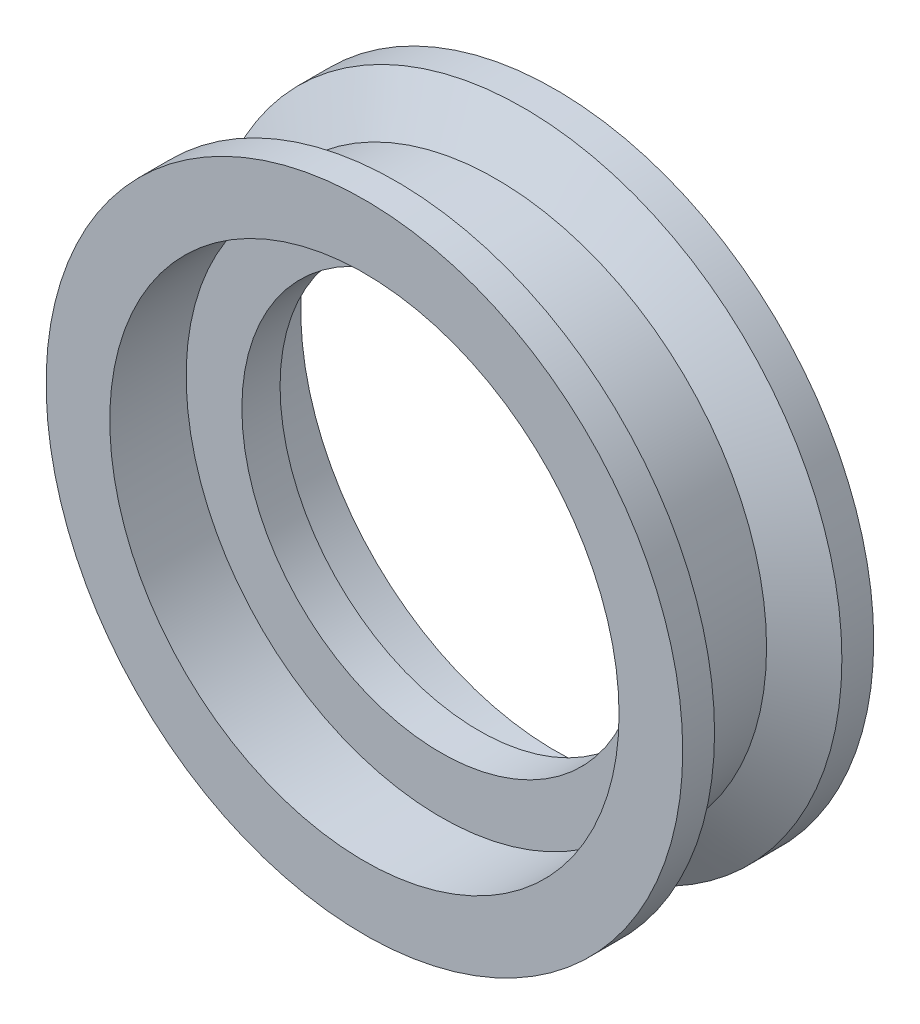
from build123d import *

# Parameters (mm, degrees)
SKETCH1_R           = 10
BOSS_EXTRUDE1_DEPTH = 3
SKETCH2_R           = 8
CUT_EXTRUDE1_DEPTH  = 2.4
SKETCH6_R           = 6.25
CUT_EXTRUDE2_DEPTH  = 15.593149078


with BuildPart() as part:
    # Sketch1 → Boss-Extrude1 (new, symmetric)
    with BuildSketch(Plane.XY):
        Circle(SKETCH1_R)
        with BuildLine():
            Line((-1.521572539, 1.983637318), (-1.521572539, -2.016362682))
            ThreePointArc((-1.521572539, -2.016362682), (-0.016245384, -2.500087973), (1.478251514, -1.983871914))
            Line((1.478251514, -1.983871914), (1.478251514, 2.016128086))
            ThreePointArc((1.478251514, 2.016128086), (-0.02707564, 2.499853378), (-1.521572539, 1.983637318))
        make_face(mode=Mode.SUBTRACT)
    extrude(amount=BOSS_EXTRUDE1_DEPTH, both=True)

    # Sketch2 → Cut-Extrude1 (cut)
    with BuildSketch(Plane.XY.offset(3)):
        Circle(SKETCH2_R)
    cut_extrude1 = extrude(amount=-CUT_EXTRUDE1_DEPTH, mode=Mode.SUBTRACT)

    # Mirror1: Cut-Extrude1 across plane
    add(cut_extrude1.mirror(Plane.XY), mode=Mode.SUBTRACT)

    # Sketch5 → Cut-Revolve1 (revolve, cut)
    with BuildSketch(Plane(origin=(0, 0, 0), x_dir=(1, 0, 0), z_dir=(0, 1, 0))):
        Polygon((-10, 2), (-8.5, 1.133974596), (-8.5, -1.133974596), (-10, -2), align=None)
    revolve(axis=Axis((0, 0, 0), (0, 0, -1)), mode=Mode.SUBTRACT)

    # Sketch6 → Cut-Extrude2 (cut, through all)
    with BuildSketch(Plane(origin=(0, 0, -0.6), x_dir=(-1, 0, 0), z_dir=(0, 0, -1))):
        Circle(SKETCH6_R)
    extrude(amount=-CUT_EXTRUDE2_DEPTH, mode=Mode.SUBTRACT)


solid = part.part
